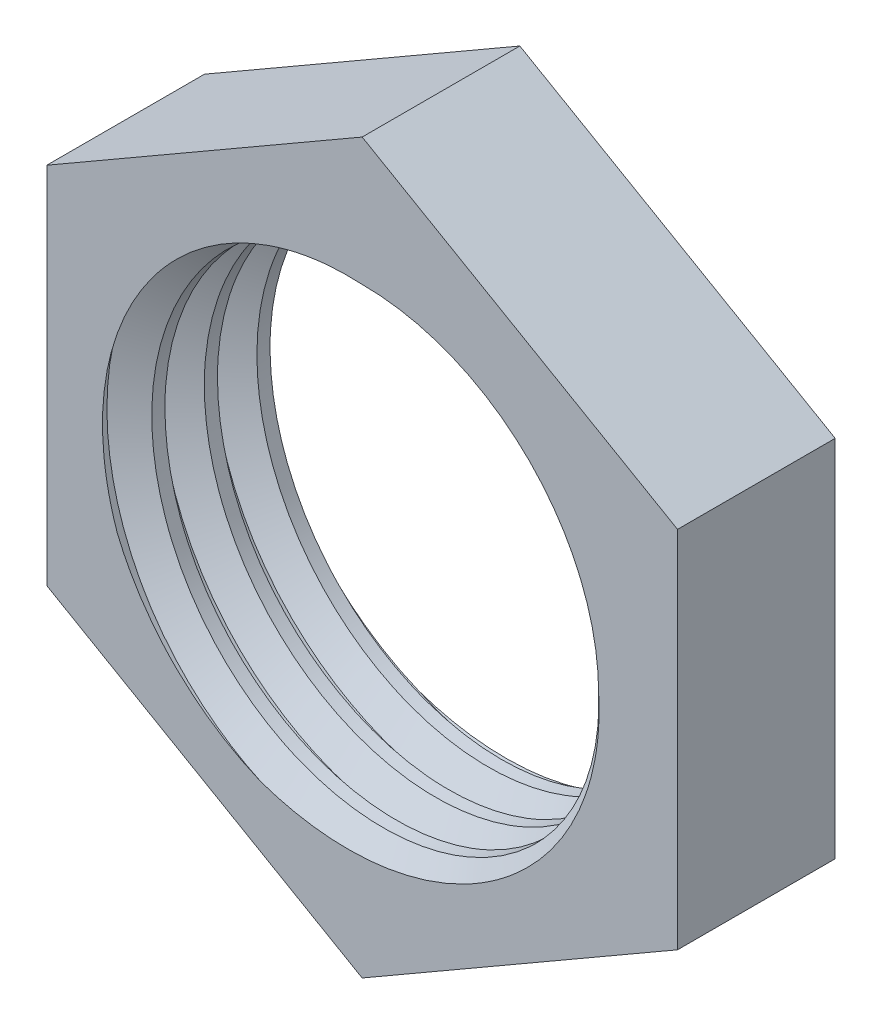
from build123d import *

# Parameters (mm, degrees)
SZKIC5_R                    = 6
SZKIC5_R_2                  = 4.5
DODANIE_WYCI_GNI_CIE4_DEPTH = 3
GWINT2_PITCH                = 1
DODANIE_WYCI_GNI_CIE5_START = -3
DODANIE_WYCI_GNI_CIE5_DEPTH = 3


with BuildPart() as part:
    # Szkic5 → Dodanie-wyciągnięcie4 (new body)
    with BuildSketch(Plane.XY):
        with Locations((55.55, -8.9)):
            Circle(SZKIC5_R)
        with Locations((55.55, -8.9)):
            Circle(SZKIC5_R_2, mode=Mode.SUBTRACT)
    extrude(amount=-DODANIE_WYCI_GNI_CIE4_DEPTH)

    # Gwint2: the profile of Profil gwintu2 profile screwed along a right-hand helix of 10 turns, 8 arcs to a turn; built about Z, then put on its axis
    gwint2_z = Axis((0, 0, 0), (0, 0, 1))
    gwint2_corners = [(4.4997, 0, -0.000173205), (5.041265875, 0, 0.312499999), (5.041265875, 0, 0.437499999), (4.4997, 0, 0.750173202)]
    with BuildLine(mode=Mode.PRIVATE) as gwint2_profile:
        Line(gwint2_corners[0], gwint2_corners[1])
        Line(gwint2_corners[1], gwint2_corners[2])
        Line(gwint2_corners[2], gwint2_corners[3])
        Line(gwint2_corners[3], gwint2_corners[0])
    gwint2_cap = Face(gwint2_profile.wire())
    gwint2_turn_angles = [0, 22.5, 45, 67.5, 90, 112.5, 135, 157.5, 180, 202.5, 225, 247.5, 270, 292.5, 315, 337.5, 360]
    gwint2_turn_weights = [1, 0.9238795325112867, 1, 0.9238795325112867, 1, 0.9238795325112867, 1, 0.9238795325112867, 1, 0.9238795325112867, 1, 0.9238795325112867, 1, 0.9238795325112867, 1, 0.9238795325112867, 1]
    gwint2_turn_rails = [Edge.make_bspline([Vector(p[0], p[1], 0).rotate(gwint2_z, gwint2_turn_angles[k]) / gwint2_turn_weights[k] + Vector(0, 0, p[2] + GWINT2_PITCH * gwint2_turn_angles[k] / 360) for k in range(17)], [0, 0, 0, 1, 1, 2, 2, 3, 3, 4, 4, 5, 5, 6, 6, 7, 7, 8, 8, 8], 2, gwint2_turn_weights) for p in gwint2_corners]
    gwint2_turn_sides = [Face.make_surface_from_curves(gwint2_turn_rails[p[0]], gwint2_turn_rails[p[1]]) for p in [(0, 1), (1, 2), (2, 3), (3, 0)]]
    gwint2 = Plane(origin=(55.55, -8.9, -4), x_dir=(1, 0, 0), z_dir=(0, 0, 1)) * Solid(Shell([*[p.moved(Location((0, 0, GWINT2_PITCH * i))) for i in range(10) for p in gwint2_turn_sides], gwint2_cap, gwint2_cap.rotate(gwint2_z, 3600).moved(Location((0, 0, GWINT2_PITCH * 3600 / 360)))]))
    add(gwint2, mode=Mode.SUBTRACT)

    # Szkic8 → Dodanie-wyciągnięcie5 (add)
    with BuildSketch(Plane(origin=(0, 0, -3), x_dir=(-1, 0, 0), z_dir=(0, 0, -1)).offset(DODANIE_WYCI_GNI_CIE5_START)):
        with BuildLine():
            Line((-61.55, -12.364101615), (-58.550000295, -14.096152252))
            ThreePointArc((-58.550000295, -14.096152252), (-60.746152508, -11.899999853), (-61.55, -8.9))
            Line((-61.55, -8.9), (-61.55, -12.364101615))
        make_face()
        with BuildLine():
            Line((-58.550000295, -14.096152252), (-55.55, -15.82820323))
            Line((-55.55, -15.82820323), (-52.550000104, -14.096152482))
            ThreePointArc((-52.550000104, -14.096152482), (-55.55000023, -14.9), (-58.550000295, -14.096152252))
        make_face()
        with BuildLine():
            ThreePointArc((-49.55, -8.9), (-50.353847607, -11.900000052), (-52.550000104, -14.096152482))
            Line((-52.550000104, -14.096152482), (-49.55, -12.364101615))
            Line((-49.55, -12.364101615), (-49.55, -8.9))
        make_face()
        with BuildLine():
            ThreePointArc((-52.549999949, -3.703847607), (-50.353847563, -5.900000025), (-49.55, -8.9))
            Line((-49.55, -8.9), (-49.55, -5.435898385))
            Line((-49.55, -5.435898385), (-52.549999949, -3.703847607))
        make_face()
        with BuildLine():
            ThreePointArc((-58.550000187, -3.703847685), (-55.550000079, -2.9), (-52.549999949, -3.703847607))
            Line((-52.549999949, -3.703847607), (-55.55, -1.97179677))
            Line((-55.55, -1.97179677), (-58.550000187, -3.703847685))
        make_face()
        with BuildLine():
            Line((-61.55, -5.435898385), (-61.55, -8.9))
            ThreePointArc((-61.55, -8.9), (-60.746152477, -5.900000094), (-58.550000187, -3.703847685))
            Line((-58.550000187, -3.703847685), (-61.55, -5.435898385))
        make_face()
    extrude(amount=DODANIE_WYCI_GNI_CIE5_DEPTH)


solid = part.part
